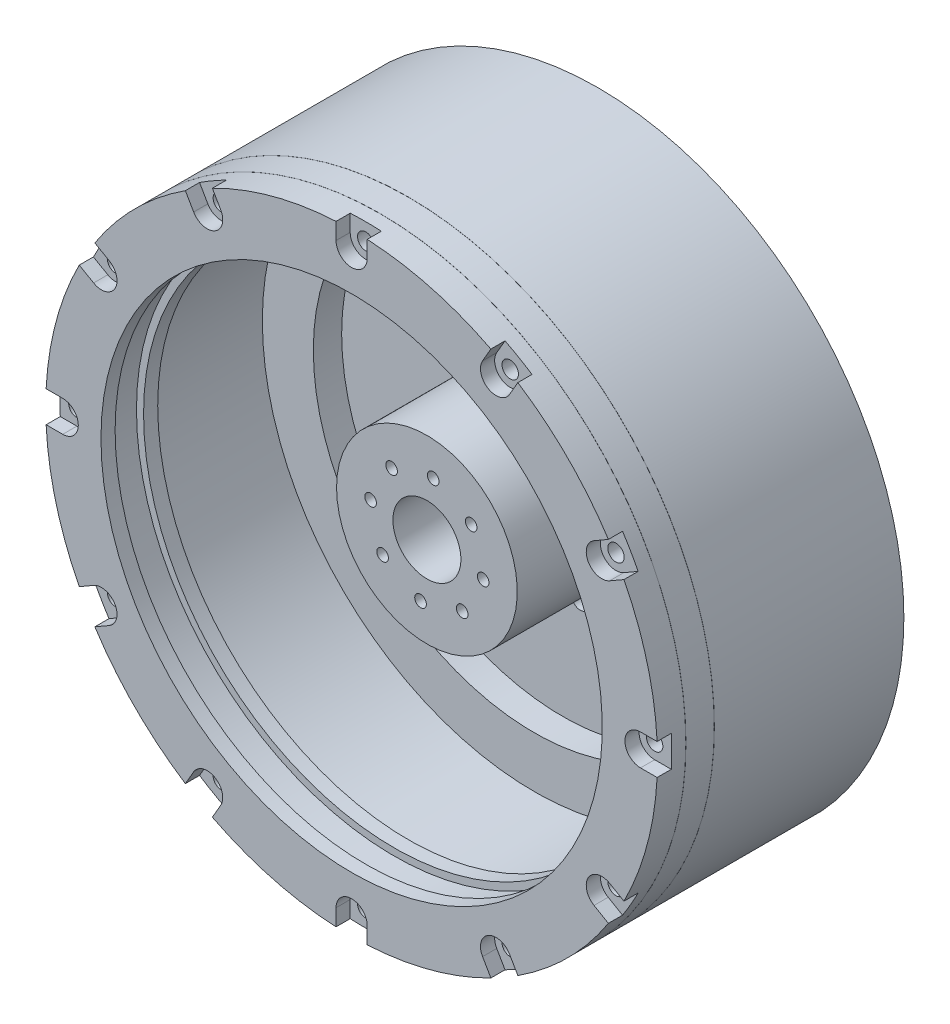
from build123d import *

# Parameters (mm, degrees)
ADVANCEDHOLE1_START              = 27.22
ADVANCEDHOLE1_OUTLINE_R          = 1.45
ADVANCEDHOLE1_DEPTH              = 10.02
ADVANCEDHOLE1_START_2            = 34.74
ADVANCEDHOLE1_2_OUTLINE_R        = 2.75
ADVANCEDHOLE1_2_OUTLINE_R_2      = 1.45
ADVANCEDHOLE1_2_DEPTH            = 2.5
CUT_EXTRUDE1_DEPTH               = 87.674315148
CIRPATTERN1_COUNT                = 12
SKETCH5_R                        = 1.35
CUT_EXTRUDE2_DEPTH               = 85.963625158
CBORE_FOR_M2_5_SHCS1_D           = 2.9
CBORE_FOR_M2_5_SHCS1_CBORE_D     = 5.5
CBORE_FOR_M2_5_SHCS1_CBORE_DEPTH = 2.5
M2_5X0_45_TAPPED_HOLE1_D         = 2.05
M2_5X0_45_TAPPED_HOLE1_DEPTH     = 6.35
M2_5X0_45_TAPPED_HOLE1_TIP       = 0.615882135


# Read off the part's stored shape, not the designer's step: AdvancedHole1
with BuildPart() as part:
    # Sketch1 → Revolve1 (revolve)
    with BuildSketch(Plane.YZ, mode=Mode.PRIVATE) as revolve1_sk:
        Polygon((6, 23.95), (15.95, 23.95), (15.95, 0), (39, 0), (39, 5), (48, 5), (48, 27.2), (54, 27.2), (54, -6.253132429), (6, -6.253132429), align=None)
        Polygon((44.25, 29.72), (44.25, 27.22), (54, 27.22), (54, 32.22), (47.5, 32.22), (47.5, 34.72), (45.5, 34.72), (45.5, 29.72), align=None)
        Polygon((47.7, 34.74), (44.25, 34.74), (44.25, 37.24), (54, 37.24), (54, 32.24), (47.7, 32.24), align=None)
    revolve(revolve1_sk.sketch.rotate(Axis((0, 0, 23.95), (0, 0, 1)), 90), axis=Axis((0, 0, 23.95), (0, 0, 1)))

    # AdvancedHole1 outline → AdvancedHole1 (cut)
    with BuildSketch(Plane.XY.offset(ADVANCEDHOLE1_START)):
        with Locations((44.167295593, 25.5)):
            Circle(ADVANCEDHOLE1_OUTLINE_R)
        with Locations((25.5, 44.167295593)):
            Circle(ADVANCEDHOLE1_OUTLINE_R)
        with Locations((0, 51)):
            Circle(ADVANCEDHOLE1_OUTLINE_R)
        with Locations((-25.5, 44.167295593)):
            Circle(ADVANCEDHOLE1_OUTLINE_R)
        with Locations((-44.167295593, 25.5)):
            Circle(ADVANCEDHOLE1_OUTLINE_R)
        with Locations((-51, 0)):
            Circle(ADVANCEDHOLE1_OUTLINE_R)
        with Locations((-44.167295593, -25.5)):
            Circle(ADVANCEDHOLE1_OUTLINE_R)
        with Locations((-25.5, -44.167295593)):
            Circle(ADVANCEDHOLE1_OUTLINE_R)
        with Locations((0, -51)):
            Circle(ADVANCEDHOLE1_OUTLINE_R)
        with Locations((25.5, -44.167295593)):
            Circle(ADVANCEDHOLE1_OUTLINE_R)
        with Locations((44.167295593, -25.5)):
            Circle(ADVANCEDHOLE1_OUTLINE_R)
        with Locations((51, 0)):
            Circle(ADVANCEDHOLE1_OUTLINE_R)
    extrude(amount=ADVANCEDHOLE1_DEPTH, mode=Mode.SUBTRACT)

    # AdvancedHole1 2 outline → AdvancedHole1 2 (cut)
    # profile 1 of 12: a face of its own
    with BuildSketch(Plane.XY.offset(ADVANCEDHOLE1_START_2)):
        with Locations((44.167295593, 25.5)):
            Circle(ADVANCEDHOLE1_2_OUTLINE_R)
        with Locations((44.167295593, 25.5)):
            Circle(ADVANCEDHOLE1_2_OUTLINE_R_2, mode=Mode.SUBTRACT)
    # profile 2 of 12: a face of its own
    with BuildSketch(Plane.XY.offset(ADVANCEDHOLE1_START_2)):
        with Locations((25.5, 44.167295593)):
            Circle(ADVANCEDHOLE1_2_OUTLINE_R)
        with Locations((25.5, 44.167295593)):
            Circle(ADVANCEDHOLE1_2_OUTLINE_R_2, mode=Mode.SUBTRACT)
    # profile 3 of 12: a face of its own
    with BuildSketch(Plane.XY.offset(ADVANCEDHOLE1_START_2)):
        with Locations((0, 51)):
            Circle(ADVANCEDHOLE1_2_OUTLINE_R)
        with Locations((0, 51)):
            Circle(ADVANCEDHOLE1_2_OUTLINE_R_2, mode=Mode.SUBTRACT)
    # profile 4 of 12: a face of its own
    with BuildSketch(Plane.XY.offset(ADVANCEDHOLE1_START_2)):
        with Locations((-25.5, 44.167295593)):
            Circle(ADVANCEDHOLE1_2_OUTLINE_R)
        with Locations((-25.5, 44.167295593)):
            Circle(ADVANCEDHOLE1_2_OUTLINE_R_2, mode=Mode.SUBTRACT)
    # profile 5 of 12: a face of its own
    with BuildSketch(Plane.XY.offset(ADVANCEDHOLE1_START_2)):
        with Locations((-44.167295593, 25.5)):
            Circle(ADVANCEDHOLE1_2_OUTLINE_R)
        with Locations((-44.167295593, 25.5)):
            Circle(ADVANCEDHOLE1_2_OUTLINE_R_2, mode=Mode.SUBTRACT)
    # profile 6 of 12: a face of its own
    with BuildSketch(Plane.XY.offset(ADVANCEDHOLE1_START_2)):
        with Locations((-51, 0)):
            Circle(ADVANCEDHOLE1_2_OUTLINE_R)
        with Locations((-51, 0)):
            Circle(ADVANCEDHOLE1_2_OUTLINE_R_2, mode=Mode.SUBTRACT)
    # profile 7 of 12: a face of its own
    with BuildSketch(Plane.XY.offset(ADVANCEDHOLE1_START_2)):
        with Locations((-44.167295593, -25.5)):
            Circle(ADVANCEDHOLE1_2_OUTLINE_R)
        with Locations((-44.167295593, -25.5)):
            Circle(ADVANCEDHOLE1_2_OUTLINE_R_2, mode=Mode.SUBTRACT)
    # profile 8 of 12: a face of its own
    with BuildSketch(Plane.XY.offset(ADVANCEDHOLE1_START_2)):
        with Locations((-25.5, -44.167295593)):
            Circle(ADVANCEDHOLE1_2_OUTLINE_R)
        with Locations((-25.5, -44.167295593)):
            Circle(ADVANCEDHOLE1_2_OUTLINE_R_2, mode=Mode.SUBTRACT)
    # profile 9 of 12: a face of its own
    with BuildSketch(Plane.XY.offset(ADVANCEDHOLE1_START_2)):
        with Locations((0, -51)):
            Circle(ADVANCEDHOLE1_2_OUTLINE_R)
        with Locations((0, -51)):
            Circle(ADVANCEDHOLE1_2_OUTLINE_R_2, mode=Mode.SUBTRACT)
    # profile 10 of 12: a face of its own
    with BuildSketch(Plane.XY.offset(ADVANCEDHOLE1_START_2)):
        with Locations((25.5, -44.167295593)):
            Circle(ADVANCEDHOLE1_2_OUTLINE_R)
        with Locations((25.5, -44.167295593)):
            Circle(ADVANCEDHOLE1_2_OUTLINE_R_2, mode=Mode.SUBTRACT)
    # profile 11 of 12: a face of its own
    with BuildSketch(Plane.XY.offset(ADVANCEDHOLE1_START_2)):
        with Locations((44.167295593, -25.5)):
            Circle(ADVANCEDHOLE1_2_OUTLINE_R)
        with Locations((44.167295593, -25.5)):
            Circle(ADVANCEDHOLE1_2_OUTLINE_R_2, mode=Mode.SUBTRACT)
    # profile 12 of 12: a face of its own
    with BuildSketch(Plane.XY.offset(ADVANCEDHOLE1_START_2)):
        with Locations((51, 0)):
            Circle(ADVANCEDHOLE1_2_OUTLINE_R)
        with Locations((51, 0)):
            Circle(ADVANCEDHOLE1_2_OUTLINE_R_2, mode=Mode.SUBTRACT)
    extrude(amount=ADVANCEDHOLE1_2_DEPTH, mode=Mode.SUBTRACT)

    # AdvancedHole1 3 outline → AdvancedHole1 3 (revolve, cut)
    with BuildSketch(Plane(origin=(44.167295593, 25.5, 0), x_dir=(1, 0, 0), z_dir=(0, -1, 0))):
        Polygon((0, 21.604117865), (1.025, 22.22), (1.025, 27.2), (0, 27.2), align=None)
    revolve(axis=Axis((44.167295593, 25.5, 0), (0, 0, 1)), mode=Mode.SUBTRACT)

    # AdvancedHole1 4 outline → AdvancedHole1 4 (revolve, cut)
    with BuildSketch(Plane(origin=(25.5, 44.167295593, 0), x_dir=(1, 0, 0), z_dir=(0, -1, 0))):
        Polygon((0, 21.604117865), (1.025, 22.22), (1.025, 27.2), (0, 27.2), align=None)
    revolve(axis=Axis((25.5, 44.167295593, 0), (0, 0, 1)), mode=Mode.SUBTRACT)

    # AdvancedHole1 5 outline → AdvancedHole1 5 (revolve, cut)
    with BuildSketch(Plane.XZ.offset(-51)):
        Polygon((0, 21.604117865), (1.025, 22.22), (1.025, 27.2), (0, 27.2), align=None)
    revolve(axis=Axis((0, 51, 0), (0, 0, 1)), mode=Mode.SUBTRACT)

    # AdvancedHole1 6 outline → AdvancedHole1 6 (revolve, cut)
    with BuildSketch(Plane(origin=(-25.5, 44.167295593, 0), x_dir=(1, 0, 0), z_dir=(0, -1, 0))):
        Polygon((0, 21.604117865), (1.025, 22.22), (1.025, 27.2), (0, 27.2), align=None)
    revolve(axis=Axis((-25.5, 44.167295593, 0), (0, 0, 1)), mode=Mode.SUBTRACT)

    # AdvancedHole1 7 outline → AdvancedHole1 7 (revolve, cut)
    with BuildSketch(Plane(origin=(-44.167295593, 25.5, 0), x_dir=(1, 0, 0), z_dir=(0, -1, 0))):
        Polygon((0, 21.604117865), (1.025, 22.22), (1.025, 27.2), (0, 27.2), align=None)
    revolve(axis=Axis((-44.167295593, 25.5, 0), (0, 0, 1)), mode=Mode.SUBTRACT)

    # AdvancedHole1 8 outline → AdvancedHole1 8 (revolve, cut)
    with BuildSketch(Plane(origin=(-51, 0, 0), x_dir=(1, 0, 0), z_dir=(0, -1, 0))):
        Polygon((0, 21.604117865), (1.025, 22.22), (1.025, 27.2), (0, 27.2), align=None)
    revolve(axis=Axis((-51, 0, 0), (0, 0, 1)), mode=Mode.SUBTRACT)

    # AdvancedHole1 9 outline → AdvancedHole1 9 (revolve, cut)
    with BuildSketch(Plane(origin=(-44.167295593, -25.5, 0), x_dir=(1, 0, 0), z_dir=(0, -1, 0))):
        Polygon((0, 21.604117865), (1.025, 22.22), (1.025, 27.2), (0, 27.2), align=None)
    revolve(axis=Axis((-44.167295593, -25.5, 0), (0, 0, 1)), mode=Mode.SUBTRACT)

    # AdvancedHole1 10 outline → AdvancedHole1 10 (revolve, cut)
    with BuildSketch(Plane(origin=(-25.5, -44.167295593, 0), x_dir=(1, 0, 0), z_dir=(0, -1, 0))):
        Polygon((0, 21.604117865), (1.025, 22.22), (1.025, 27.2), (0, 27.2), align=None)
    revolve(axis=Axis((-25.5, -44.167295593, 0), (0, 0, 1)), mode=Mode.SUBTRACT)

    # AdvancedHole1 11 outline → AdvancedHole1 11 (revolve, cut)
    with BuildSketch(Plane.XZ.offset(51)):
        Polygon((0, 21.604117865), (1.025, 22.22), (1.025, 27.2), (0, 27.2), align=None)
    revolve(axis=Axis((0, -51, 0), (0, 0, 1)), mode=Mode.SUBTRACT)

    # AdvancedHole1 12 outline → AdvancedHole1 12 (revolve, cut)
    with BuildSketch(Plane(origin=(25.5, -44.167295593, 0), x_dir=(1, 0, 0), z_dir=(0, -1, 0))):
        Polygon((0, 21.604117865), (1.025, 22.22), (1.025, 27.2), (0, 27.2), align=None)
    revolve(axis=Axis((25.5, -44.167295593, 0), (0, 0, 1)), mode=Mode.SUBTRACT)

    # AdvancedHole1 13 outline → AdvancedHole1 13 (revolve, cut)
    with BuildSketch(Plane(origin=(44.167295593, -25.5, 0), x_dir=(1, 0, 0), z_dir=(0, -1, 0))):
        Polygon((0, 21.604117865), (1.025, 22.22), (1.025, 27.2), (0, 27.2), align=None)
    revolve(axis=Axis((44.167295593, -25.5, 0), (0, 0, 1)), mode=Mode.SUBTRACT)

    # AdvancedHole1 14 outline → AdvancedHole1 14 (revolve, cut)
    with BuildSketch(Plane(origin=(51, 0, 0), x_dir=(1, 0, 0), z_dir=(0, -1, 0))):
        Polygon((0, 21.604117865), (1.025, 22.22), (1.025, 27.2), (0, 27.2), align=None)
    revolve(axis=Axis((51, 0, 0), (0, 0, 1)), mode=Mode.SUBTRACT)

    # Sketch4 → Cut-Extrude1 (cut, through all)
    with BuildSketch(Plane.XY.offset(34.74)):
        with BuildLine():
            Line((51, 2.75), (56.946635382, 2.75))
            ThreePointArc((56.946635382, 2.75), (59.696635382, 0), (56.946635382, -2.75))
            Line((56.946635382, -2.75), (51, -2.75))
            ThreePointArc((51, -2.75), (48.25, 0), (51, 2.75))
        make_face()
    cut_extrude1 = extrude(amount=CUT_EXTRUDE1_DEPTH, mode=Mode.SUBTRACT)

    # CirPattern1: Cut-Extrude1 ×12 about axis
    cirpattern1_axis = Axis((0, 0, 0), (0, 0, 1))
    for i in range(1, CIRPATTERN1_COUNT):
        add(cut_extrude1.rotate(cirpattern1_axis, i * 360 / CIRPATTERN1_COUNT), mode=Mode.SUBTRACT)

    # Sketch5 → Cut-Extrude2 (cut, through all)
    with BuildSketch(Plane.XY):
        with Locations((3.117920116, -19.755469474)):
            Circle(SKETCH5_R)
        with Locations((-19.755469474, -3.117920116)):
            Circle(SKETCH5_R)
        with Locations((19.755469474, 3.117920116)):
            Circle(SKETCH5_R)
        with BuildLine():
            Line((-7.640200595, 29.165516194), (-1.713559753, 30.100892229))
            ThreePointArc((-1.713559753, 30.100892229), (1.145613946, 28.021198559), (-0.934079724, 25.16202486))
            Line((-0.934079724, 25.16202486), (-6.860720566, 24.226648825))
            ThreePointArc((-6.860720566, 24.226648825), (-9.719894265, 26.306342495), (-7.640200595, 29.165516194))
        make_face()
        with BuildLine():
            Line((15.220696627, 26.025571928), (22.498964627, 20.73153614))
            ThreePointArc((22.498964627, 20.73153614), (23.050140241, 17.239229532), (19.557833633, 16.688053918))
            Line((19.557833633, 16.688053918), (12.279565634, 21.982089706))
            ThreePointArc((12.279565634, 21.982089706), (11.728390019, 25.474396314), (15.220696627, 26.025571928))
        make_face()
    extrude(amount=-CUT_EXTRUDE2_DEPTH, mode=Mode.SUBTRACT)

    # CBORE for M2.5 SHCS1 (through all)
    with Locations(Plane(origin=(0, 0, -6.253132429), x_dir=(-1, 0, 0), z_dir=(0, 0, -1))):
        with Locations((-19.755469474, 3.117920116), (-3.117920116, -19.755469474), (19.755469474, -3.117920116)):
            CounterBoreHole(CBORE_FOR_M2_5_SHCS1_D / 2, CBORE_FOR_M2_5_SHCS1_CBORE_D / 2, CBORE_FOR_M2_5_SHCS1_CBORE_DEPTH)

    # M2.5x0.45 Tapped Hole1
    with Locations(Plane.XY.offset(23.95)):
        with Locations((9.936904492, -1.121574396), (7.819525411, 6.233379689), (1.121574396, 9.936904492), (-6.233379689, 7.819525411), (-9.936904492, 1.121574396), (-7.819525411, -6.233379689), (-1.121574396, -9.936904492), (6.233379689, -7.819525411)):
            Hole(M2_5X0_45_TAPPED_HOLE1_D / 2, depth=M2_5X0_45_TAPPED_HOLE1_DEPTH)
            with Locations((0, 0, -(M2_5X0_45_TAPPED_HOLE1_DEPTH + M2_5X0_45_TAPPED_HOLE1_TIP / 2))):  # 118° drill point
                Cone(0, M2_5X0_45_TAPPED_HOLE1_D / 2, M2_5X0_45_TAPPED_HOLE1_TIP, mode=Mode.SUBTRACT)


solid = part.part
